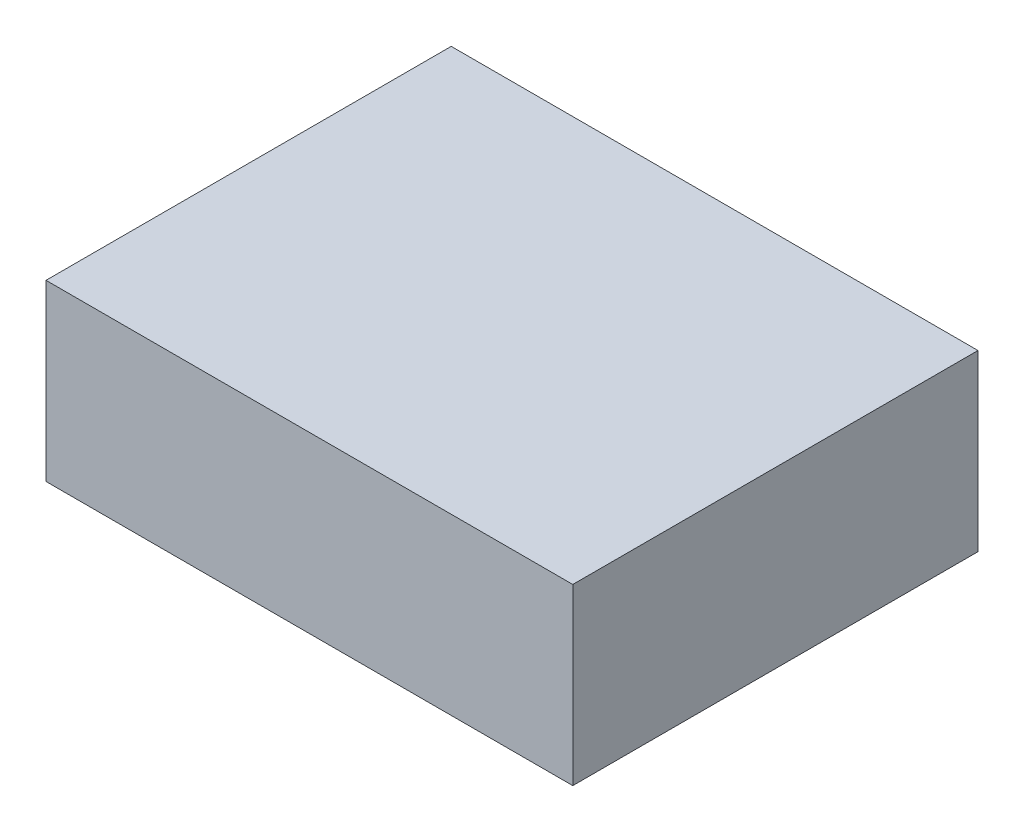
from build123d import *

# Parameters (mm, degrees)
ESBO_O1_W                = 130
ESBO_O1_H                = 100
RESSALTO_EXTRUS_O1_DEPTH = 43


with BuildPart() as part:
    # Esboço1 → Ressalto-extrusão1 (new body)
    with BuildSketch(Plane(origin=(0, 0, 0), x_dir=(1, 0, 0), z_dir=(0, 1, 0))):
        Rectangle(ESBO_O1_W, ESBO_O1_H)
    extrude(amount=RESSALTO_EXTRUS_O1_DEPTH)


solid = part.part
